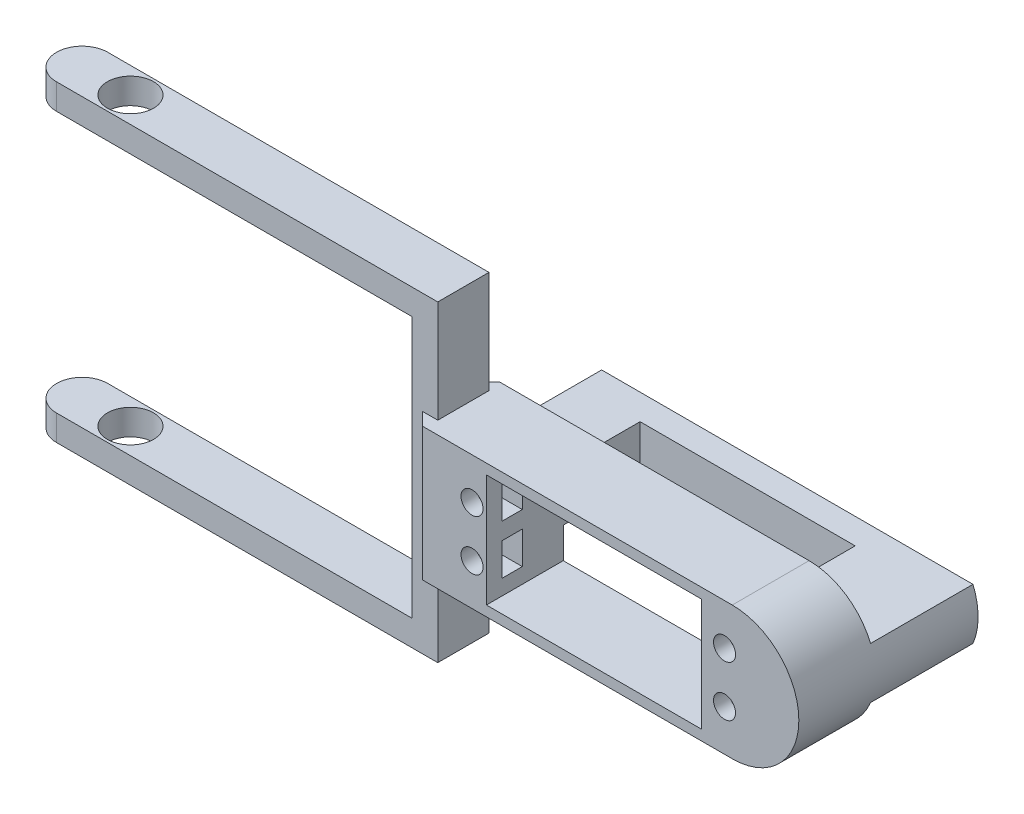
from build123d import *

# Parameters (mm, degrees)
BOSS_EXTRU_1_DEPTH      = 15
ESQUISSE2_W             = 42
ESQUISSE2_H             = 22
ENL_V_MAT_EXTRU_1_DEPTH = 48.360320945
ESQUISSE4_R             = 2.15
ENL_V_MAT_EXTRU_2_DEPTH = 3
ESQUISSE5_W             = 4
ESQUISSE5_H             = 6.35
ENL_V_MAT_EXTRU_3_DEPTH = 6
ESQUISSE6_W             = 4
ESQUISSE6_H             = 6.35
ENL_V_MAT_EXTRU_4_DEPTH = 8
BOSS_EXTRU_2_DEPTH      = 5
BOSS_EXTRU_2_DEPTH_BACK = 5
CHANFREIN1_SIZE         = 3
BOSS_EXTRU_4_DEPTH      = 5
BOSS_EXTRU_6_START      = 20
ESQUISSE13_W            = 12.5
ESQUISSE13_H            = 10
BOSS_EXTRU_6_DEPTH      = 20
ESQUISSE14_W            = 42
ESQUISSE14_H            = 10
BOSS_EXTRU_7_DEPTH      = 5
BOSS_EXTRU_8_START      = -5
BOSS_EXTRU_8_DEPTH      = 5
ESQUISSE17_R            = 4.5
ENL_V_MAT_EXTRU_5_DEPTH = 127.873828497


with BuildPart() as part:
    # Esquisse1 → Boss.-Extru.1 (new body)
    with BuildSketch(Plane.XY):
        with BuildLine():
            Line((30, -13), (-30, -13))
            Line((-30, -13), (-30, 13))
            Line((-30, 13), (30, 13))
            ThreePointArc((30, 13), (43, 0), (30, -13))
        make_face()
    extrude(amount=BOSS_EXTRU_1_DEPTH)

    # Esquisse2 → Enlèv. mat.-Extru.1 (cut, through all)
    with BuildSketch(Plane.XY.offset(15)):
        with Locations((3, 0)):
            Rectangle(ESQUISSE2_W, ESQUISSE2_H)
    extrude(amount=-ENL_V_MAT_EXTRU_1_DEPTH, mode=Mode.SUBTRACT)

    # Esquisse4 → Enlèv. mat.-Extru.2 (cut)
    with BuildSketch(Plane.XY.offset(15)):
        with Locations((-20.81, 4.935)):
            Circle(ESQUISSE4_R)
        with Locations((-20.81, -4.935)):
            Circle(ESQUISSE4_R)
        with Locations((28.49, 4.935)):
            Circle(ESQUISSE4_R)
        with Locations((28.49, -4.935)):
            Circle(ESQUISSE4_R)
    extrude(amount=-ENL_V_MAT_EXTRU_2_DEPTH, mode=Mode.SUBTRACT)

    # Esquisse5 → Enlèv. mat.-Extru.3 (cut)
    with BuildSketch(Plane(origin=(-18, 0, 0), x_dir=(0, 0, -1), z_dir=(1, 0, 0))):
        with Locations((-10, -4.825)):
            Rectangle(ESQUISSE5_W, ESQUISSE5_H)
        with Locations((-10, 4.825)):
            Rectangle(ESQUISSE5_W, ESQUISSE5_H)
    extrude(amount=-ENL_V_MAT_EXTRU_3_DEPTH, mode=Mode.SUBTRACT)

    # Esquisse6 → Enlèv. mat.-Extru.4 (cut)
    with BuildSketch(Plane.ZY.offset(-24)):
        with Locations((10, 4.825)):
            Rectangle(ESQUISSE6_W, ESQUISSE6_H)
        with Locations((10, -4.825)):
            Rectangle(ESQUISSE6_W, ESQUISSE6_H)
    extrude(amount=-ENL_V_MAT_EXTRU_4_DEPTH, mode=Mode.SUBTRACT)

    # Esquisse9 → Boss.-Extru.2 (add, two sides: drawn at the far end of the back side and taken through both)
    with BuildSketch(Plane.XY.offset(7.5).offset(-BOSS_EXTRU_2_DEPTH_BACK)):
        Polygon((-30, 33), (-95, 33), (-95, 28), (-35, 28), (-35, 0), (-35, -23), (-95, -23), (-95, -28), (-30, -28), (-30, 0), align=None)
    extrude(amount=BOSS_EXTRU_2_DEPTH + BOSS_EXTRU_2_DEPTH_BACK)

    # Chanfrein1
    # the kernel refuses this chamfer: 3 mm, written as the material it adds along each edge
    with BuildSketch(Plane(origin=(-30, 13, 12.5), x_dir=(0.02749587661058678, 0, 0.9996219169112968), z_dir=(0, -1, 0))) as chanfrein1_piece_1_section:
        Polygon((CHANFREIN1_SIZE * 0.999621916911, CHANFREIN1_SIZE * 0.0274958766106), (-CHANFREIN1_SIZE * 0.0274958766106, CHANFREIN1_SIZE * 0.999621916911), (0, 0), align=None)
    chanfrein1_piece_1 = extrude(amount=26, mode=Mode.PRIVATE)
    chanfrein1_piece_1 = split(chanfrein1_piece_1, bisect_by=Plane(origin=(-31.023809524, 0, 15), z_dir=(0, 0, -1)), keep=Keep.TOP, mode=Mode.PRIVATE)
    add(chanfrein1_piece_1)
    with BuildSketch(Plane(origin=(-30, -13, 2.5), x_dir=(0.027495876610585626, 0, -0.9996219169112968), z_dir=(0, 1, 0))) as chanfrein1_piece_2_section:
        Polygon((CHANFREIN1_SIZE * 0.999621916911, CHANFREIN1_SIZE * 0.0274958766106), (-CHANFREIN1_SIZE * 0.0274958766106, CHANFREIN1_SIZE * 0.999621916911), (0, 0), align=None)
    chanfrein1_piece_2 = extrude(amount=26, mode=Mode.PRIVATE)
    chanfrein1_piece_2 = split(chanfrein1_piece_2, bisect_by=Plane(origin=(-31.023809524, 0, 0), z_dir=(0, 0, 1)), keep=Keep.TOP, mode=Mode.PRIVATE)
    add(chanfrein1_piece_2)

    # Esquisse11 → Boss.-Extru.4 (add)
    with BuildSketch(Plane.XZ.offset(28)):
        with BuildLine():
            Line((-95, 2.5), (-95, 12.5))
            Line((-95, 12.5), (-104.43476759, 12.5))
            ThreePointArc((-104.43476759, 12.5), (-109.43476759, 7.5), (-104.43476759, 2.5))
            Line((-104.43476759, 2.5), (-95, 2.5))
        make_face()
    extrude(amount=-BOSS_EXTRU_4_DEPTH)

    # Esquisse13 → Boss.-Extru.6 (add)
    with BuildSketch(Plane(origin=(0, 0, 0), x_dir=(-1, 0, 0), z_dir=(0, 0, -1)).offset(BOSS_EXTRU_6_START)):
        with BuildLine():
            Line((-24, -5), (-24, 5))
            Line((-24, 5), (-42, 5))
            ThreePointArc((-42, 5), (-43, 0), (-42, -5))
            Line((-42, -5), (-24, -5))
        make_face()
        with Locations((24.25, 0)):
            Rectangle(ESQUISSE13_W, ESQUISSE13_H)
    extrude(amount=-BOSS_EXTRU_6_DEPTH)

    # Esquisse14 → Boss.-Extru.7 (add)
    with BuildSketch(Plane(origin=(0, 0, -20), x_dir=(-1, 0, 0), z_dir=(0, 0, -1))):
        with Locations((-3, 0)):
            Rectangle(ESQUISSE14_W, ESQUISSE14_H)
    extrude(amount=-BOSS_EXTRU_7_DEPTH)

    # Esquisse16 → Boss.-Extru.8 (add)
    with BuildSketch(Plane(origin=(0, 33, 0), x_dir=(1, 0, 0), z_dir=(0, 1, 0)).offset(BOSS_EXTRU_8_START)):
        with BuildLine():
            Line((-89.416041875, -12.5), (-104.43476759, -12.5))
            ThreePointArc((-104.43476759, -12.5), (-109.43476759, -7.5), (-104.43476759, -2.5))
            Line((-104.43476759, -2.5), (-89.416041875, -2.5))
            Line((-89.416041875, -2.5), (-89.416041875, -12.5))
        make_face()
    extrude(amount=BOSS_EXTRU_8_DEPTH)

    # Esquisse17 → Enlèv. mat.-Extru.5 (cut, through all)
    with BuildSketch(Plane.XZ.offset(28)):
        with Locations((-95, 7.5)):
            Circle(ESQUISSE17_R)
    extrude(amount=-ENL_V_MAT_EXTRU_5_DEPTH, mode=Mode.SUBTRACT)


solid = part.part
